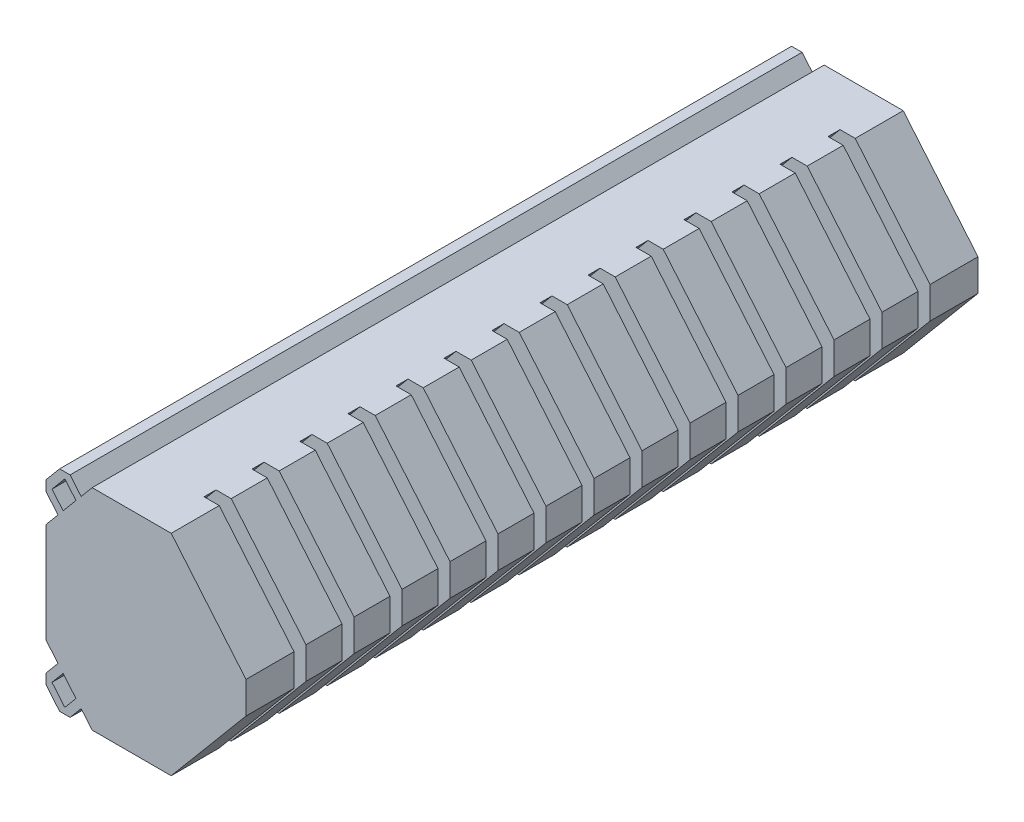
from build123d import *

# Parameters (mm, degrees)
AUFSATZ_LINEAR_AUSTRAGEN2_DEPTH      = 1.8
SCHNITT_LINEAR_AUSTRAGEN1_DEPTH      = 0.5
SCHNITT_LINEAR_AUSTRAGEN2_DEPTH      = 16.313066316
AUFSATZ_LINEAR_AUSTRAGEN3_DEPTH      = 1.2
LINEARES_MUSTER1_COUNT               = 15
LINEARES_MUSTER1_PITCH               = 4.8
AUFSATZ_LINEAR_AUSTRAGEN4_DEPTH      = 1.2
AUFSATZ_LINEAR_AUSTRAGEN4_DEPTH_BACK = 0.8
AUFSATZ_LINEAR_AUSTRAGEN5_DEPTH      = 1.2
AUFSATZ_LINEAR_AUSTRAGEN5_DEPTH_BACK = 0.8
AUFSATZ_LINEAR_AUSTRAGEN6_DEPTH      = 73.2
SCHNITT_LINEAR_AUSTRAGEN4_REACH      = 75.745
AUFSATZ_LINEAR_START                 = -2.5
AUFSATZ_LINEAR_AUSTRAGEN7_DEPTH      = 2.5


with BuildPart() as part:
    # Skizze3 → Aufsatz-Linear austragen2 (new, symmetric)
    with BuildSketch(Plane.XY):
        Polygon((-11, -5), (-11, 5), (-6.384952029, 10.5), (1.519985058, 10.5), (9, 1.58566532), (9, -1.58566532), (1.519985058, -10.5), (-6.384952029, -10.5), align=None)
    aufsatz_linear_austragen2 = extrude(amount=AUFSATZ_LINEAR_AUSTRAGEN2_DEPTH, both=True)

    # Skizze2 → Schnitt-Linear austragen1 (cut, symmetric)
    with BuildSketch(Plane.XY):
        Polygon((-7.551896681, 0), (0, 9), (7, 0.657724852), (7, -0.657724852), (0, -9), align=None)
    schnitt_linear_austragen1 = extrude(amount=SCHNITT_LINEAR_AUSTRAGEN1_DEPTH, both=True, mode=Mode.SUBTRACT)

    # Skizze5 → Schnitt-Linear austragen2 (cut, symmetric)
    with BuildSketch(Plane.XY):
        Polygon((-7.551896681, 0), (-6.716272788, 0.995857776), (-5.880648895, 0), (-6.716272788, -0.995857776), align=None)
    schnitt_linear_austragen2 = extrude(amount=SCHNITT_LINEAR_AUSTRAGEN2_DEPTH, both=True, mode=Mode.SUBTRACT)

    # Skizze6 → Aufsatz-Linear austragen3 (add)
    with BuildSketch(Plane.XY.offset(1.8)):
        Polygon((0, 10.5), (-6.384952029, 10.5), (-11, 5), (-11, -5), (-6.384952029, -10.5), (0, -10.5), (-4.580648895, -5.040995222), (-4.580648895, 5.040995222), align=None)
        Polygon((-7.551896681, 0), (-6.716272788, 0.995857776), (-5.880648895, 0), (-6.716272788, -0.995857776), align=None, mode=Mode.SUBTRACT)
    aufsatz_linear_austragen3 = extrude(amount=AUFSATZ_LINEAR_AUSTRAGEN3_DEPTH)

    # Lineares Muster1: Aufsatz-Linear austragen2, Schnitt-Linear austragen1, Schnitt-Linear austragen2, Aufsatz-Linear austragen3 ×15
    with Locations(*[(0, 0, i * LINEARES_MUSTER1_PITCH) for i in range(1, LINEARES_MUSTER1_COUNT)]):
        add(aufsatz_linear_austragen2)
        add(schnitt_linear_austragen1, mode=Mode.SUBTRACT)
        add(schnitt_linear_austragen2, mode=Mode.SUBTRACT)
        add(aufsatz_linear_austragen3)

    # Skizze8 → Aufsatz-Linear austragen4 (add, two sides: drawn at the far end of the back side and taken through both)
    with BuildSketch(Plane(origin=(0, 0, -1.8), x_dir=(-1, 0, 0), z_dir=(0, 0, -1)).offset(-AUFSATZ_LINEAR_AUSTRAGEN4_DEPTH_BACK)):
        Polygon((6.384952029, -10.5), (11, -5), (11, 5), (6.384952029, 10.5), (-1.519985058, 10.5), (-9, 1.58566532), (-9, -1.58566532), (-1.519985058, -10.5), align=None)
    extrude(amount=AUFSATZ_LINEAR_AUSTRAGEN4_DEPTH + AUFSATZ_LINEAR_AUSTRAGEN4_DEPTH_BACK)

    # Skizze9 → Aufsatz-Linear austragen5 (add, two sides: drawn at the far end of the back side and taken through both)
    with BuildSketch(Plane.XY.offset(69).offset(-AUFSATZ_LINEAR_AUSTRAGEN5_DEPTH_BACK)):
        Polygon((0, -10.5), (1.519985058, -10.5), (9, -1.58566532), (9, 1.58566532), (1.519985058, 10.5), (0, 10.5), (-4.580648895, 5.040995222), (-4.580648895, -5.040995222), align=None)
    extrude(amount=AUFSATZ_LINEAR_AUSTRAGEN5_DEPTH + AUFSATZ_LINEAR_AUSTRAGEN5_DEPTH_BACK)

    # Skizze10 → Aufsatz-Linear austragen6 (add)
    with BuildSketch(Plane(origin=(0, 0, -3), x_dir=(-1, 0, 0), z_dir=(0, 0, -1))):
        Polygon((9.114424781, -9.9), (10.4, -8.367911114), (9.286993513, -7.041481635), (9.801223601, -6.42864608), (11, -7.85729216), (11, -8.878530067), (9.639425177, -10.5), (8.589424384, -10.5), (7.487188206, -9.186406075), (8.001418294, -8.573570521), align=None)
    aufsatz_linear_austragen6 = extrude(amount=-AUFSATZ_LINEAR_AUSTRAGEN6_DEPTH)

    # Spiegeln1: Aufsatz-Linear austragen6 across plane
    add(aufsatz_linear_austragen6.mirror(Plane.ZX))

    # Skizze11 → Schnitt-Linear austragen4 (cut, up to next)
    with BuildSketch(Plane.ZY.offset(11), mode=Mode.PRIVATE) as schnitt_linear_austragen4_sk1:
        Polygon((-1.7, 8.470740817), (-0.500709147, 9.9), (0.698581706, 8.470740817), (-0.500709147, 7.041481635), align=None)
    schnitt_linear_austragen4_tool1 = extrude(schnitt_linear_austragen4_sk1.sketch, amount=-SCHNITT_LINEAR_AUSTRAGEN4_REACH, mode=Mode.PRIVATE) & part.part
    # Skizze11 → Schnitt-Linear austragen4 (cut, up to next)
    with BuildSketch(Plane.ZY.offset(11), mode=Mode.PRIVATE) as schnitt_linear_austragen4_sk2:
        Polygon((-0.500709147, -7.041481635), (-1.7, -8.470740817), (-0.500709147, -9.9), (0.698581706, -8.470740817), align=None)
    schnitt_linear_austragen4_tool2 = extrude(schnitt_linear_austragen4_sk2.sketch, amount=-SCHNITT_LINEAR_AUSTRAGEN4_REACH, mode=Mode.PRIVATE) & part.part
    # Skizze11 → Schnitt-Linear austragen4 (cut, up to next)
    with BuildSketch(Plane.ZY.offset(11), mode=Mode.PRIVATE) as schnitt_linear_austragen4_sk3:
        Polygon((66.501418294, -8.470740817), (67.700709147, -7.041481635), (68.9, -8.470740817), (67.700709147, -9.9), align=None)
    schnitt_linear_austragen4_tool3 = extrude(schnitt_linear_austragen4_sk3.sketch, amount=-SCHNITT_LINEAR_AUSTRAGEN4_REACH, mode=Mode.PRIVATE) & part.part
    # Skizze11 → Schnitt-Linear austragen4 (cut, up to next)
    with BuildSketch(Plane.ZY.offset(11), mode=Mode.PRIVATE) as schnitt_linear_austragen4_sk4:
        Polygon((67.700709147, 7.041481635), (68.9, 8.470740817), (67.700709147, 9.9), (66.501418294, 8.470740817), align=None)
    schnitt_linear_austragen4_tool4 = extrude(schnitt_linear_austragen4_sk4.sketch, amount=-SCHNITT_LINEAR_AUSTRAGEN4_REACH, mode=Mode.PRIVATE) & part.part
    add(schnitt_linear_austragen4_tool1.solids().sort_by_distance((-11, 8.470741, -0.500709))[0], mode=Mode.SUBTRACT)
    add(schnitt_linear_austragen4_tool2.solids().sort_by_distance((-11, -8.470741, -0.500709))[0], mode=Mode.SUBTRACT)
    add(schnitt_linear_austragen4_tool3.solids().sort_by_distance((-11, -8.470741, 67.700709))[0], mode=Mode.SUBTRACT)
    add(schnitt_linear_austragen4_tool4.solids().sort_by_distance((-11, 8.470741, 67.700709))[0], mode=Mode.SUBTRACT)

    # Skizze12 → Aufsatz-Linear austragen7 (add)
    with BuildSketch(Plane.XY.offset(70.2).offset(AUFSATZ_LINEAR_START)):
        Polygon((-5.880648895, 0), (-6.716272788, -0.995857776), (-7.551896681, 0), (-6.716272788, 0.995857776), align=None)
    extrude(amount=AUFSATZ_LINEAR_AUSTRAGEN7_DEPTH)


solid = part.part
